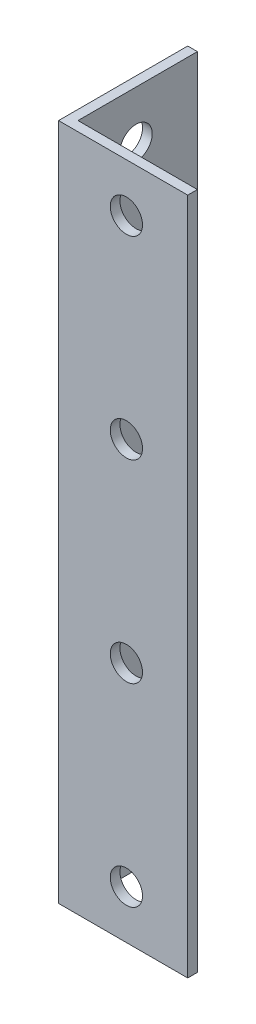
from build123d import *

# Parameters (mm, degrees)
EXTRUDE_1_DEPTH     = 210
SKETCH_2_R          = 5
CUT_EXTRUDE_1_DEPTH = 218.485631709
SKETCH_3_R          = 5
CUT_EXTRUDE_2_DEPTH = 218.485631709


with BuildPart() as part:
    # Эскиз1 → Вытянуть-Тонкостенный1 (new body)
    with BuildSketch(Plane(origin=(0, 0, 0), x_dir=(1, 0, 0), z_dir=(0, 1, 0))):
        Polygon((0, 40), (0, 0), (40, 0), (40, 3), (3, 3), (3, 40), align=None)
    extrude(amount=EXTRUDE_1_DEPTH)

    # Эскиз2 → Вырез-Вытянуть1 (cut, through all)
    with BuildSketch(Plane.ZY):
        with Locations((-21, 15)):
            Circle(SKETCH_2_R)
        with Locations((-21, 75)):
            Circle(SKETCH_2_R)
        with Locations((-21, 135)):
            Circle(SKETCH_2_R)
        with Locations((-21, 195)):
            Circle(SKETCH_2_R)
    extrude(amount=-CUT_EXTRUDE_1_DEPTH, mode=Mode.SUBTRACT)

    # Эскиз3 → Вырез-Вытянуть2 (cut, through all)
    with BuildSketch(Plane.XY):
        with Locations((21, 15)):
            Circle(SKETCH_3_R)
        with Locations((21, 75)):
            Circle(SKETCH_3_R)
        with Locations((21, 135)):
            Circle(SKETCH_3_R)
        with Locations((21, 195)):
            Circle(SKETCH_3_R)
    extrude(amount=-CUT_EXTRUDE_2_DEPTH, mode=Mode.SUBTRACT)


solid = part.part
